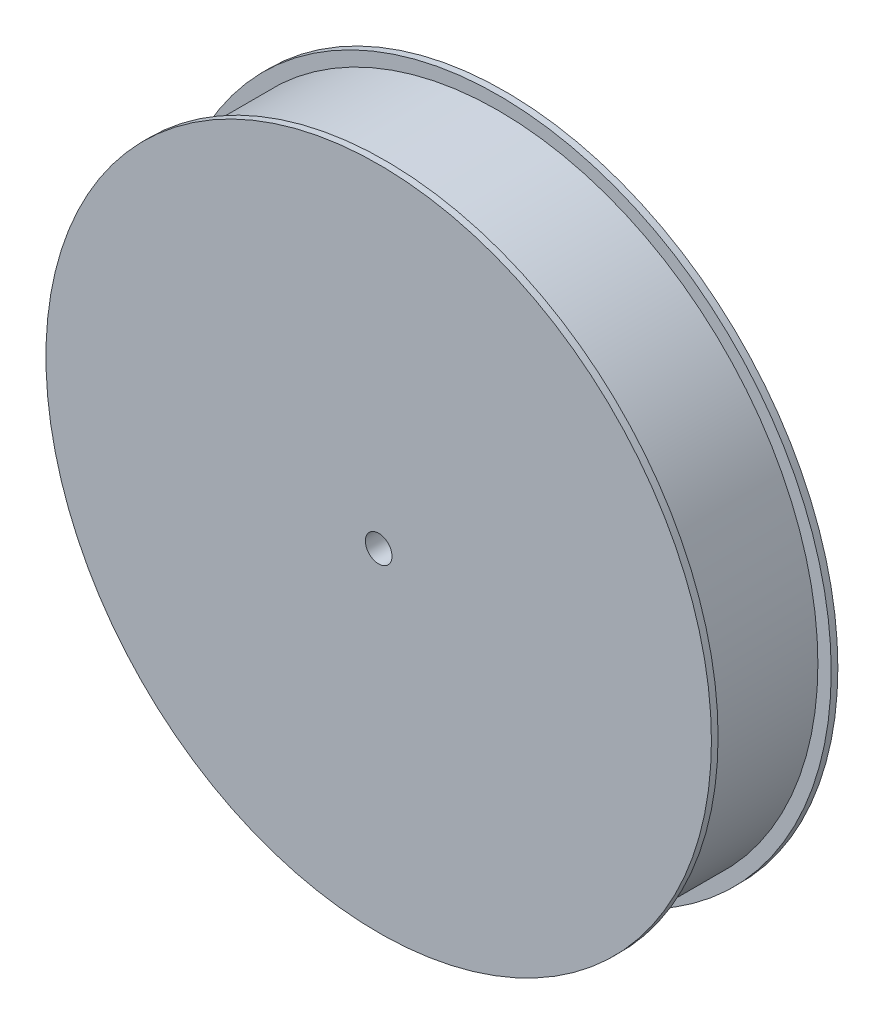
from build123d import *

# Parameters (mm, degrees)
INNER_R             = 76.2
BOSS_EXTRUDE1_DEPTH = 13.49375
RIM_R               = 79.375
BOSS_EXTRUDE2_DEPTH = 1.5875
HOLE_R              = 3.175
CUT_EXTRUDE1_DEPTH  = 117.234924426


with BuildPart() as part:
    # Inner → Boss-Extrude1 (new body)
    with BuildSketch(Plane.XY):
        Circle(INNER_R)
    extrude(amount=BOSS_EXTRUDE1_DEPTH)

    # Rim → Boss-Extrude2 (add)
    with BuildSketch(Plane.XY.offset(13.49375)):
        Circle(RIM_R)
    extrude(amount=BOSS_EXTRUDE2_DEPTH)

    # Mirror1: part across plane


with BuildPart() as part_1:
    add(part.part)
    add(part.part.mirror(Plane.XY))

    # Hole → Cut-Extrude1 (cut, through all)
    with BuildSketch(Plane.XY.offset(15.08125)):
        Circle(HOLE_R)
    extrude(amount=-CUT_EXTRUDE1_DEPTH, mode=Mode.SUBTRACT)


solid = part_1.part
